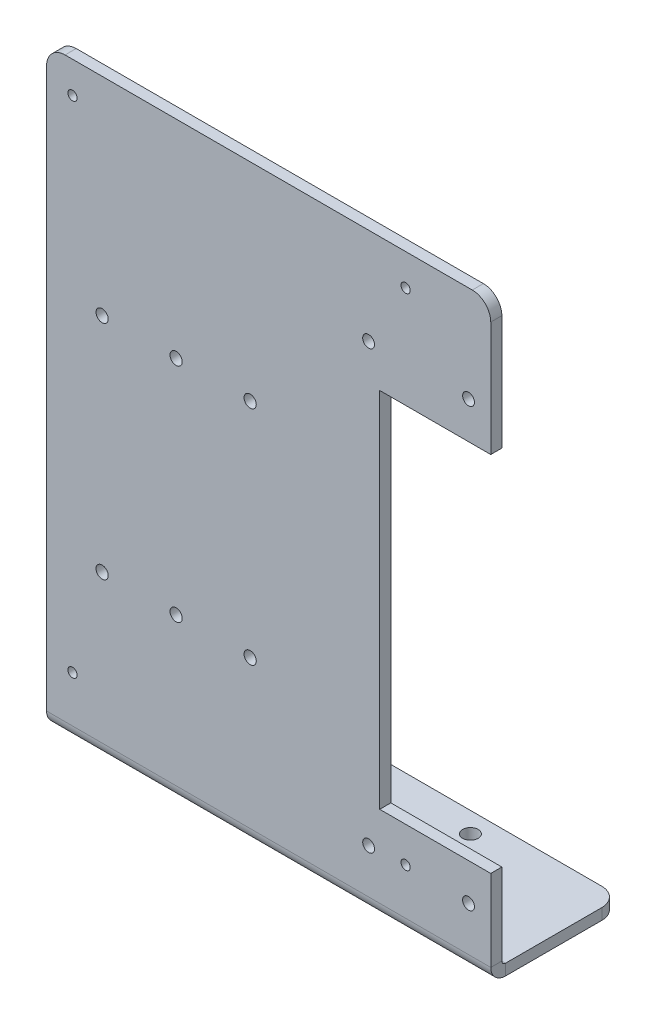
from build123d import *

# Parameters (mm, degrees)
SM_BASE_FLANGE_1_DEPTH      = 120
SKETCH_6_R                  = 1.6
CUT_EXTRUDE_1_DEPTH         = 188.147001045
PATTERN_LINEAR_1_COUNT      = 2
PATTERN_LINEAR_1_PITCH      = 118
PATTERN_LINEAR_1_COUNT_DIR2 = 5
PATTERN_LINEAR_1_PITCH_DIR2 = 27
SKETCH_7_R                  = 2.1
CUT_EXTRUDE_2_DEPTH         = 188.683243791
PATTERN_LINEAR_2_COUNT      = 2
PATTERN_LINEAR_2_PITCH      = 20
PATTERN_LINEAR_2_COUNT_DIR2 = 2
PATTERN_LINEAR_2_PITCH_DIR2 = 50
M4X0_7_TAPPED_HOLE1_D       = 3.3
PATTERN_LINEAR_4_COUNT      = 3
PATTERN_LINEAR_4_PITCH      = 20
PATTERN_LINEAR_4_COUNT_DIR2 = 4
PATTERN_LINEAR_4_PITCH_DIR2 = 20
SKETCH6_W                   = 120
SKETCH6_H                   = 3
BOSS_EXTRUDE1_DEPTH         = 20
SKETCH_11_R                 = 3.02820634
SKETCH_11_R_2               = 2.816705121
EXTRUDE_1_DEPTH             = 3
M3X0_5_1_D                  = 2.5
SKETCH_13_W                 = 30
SKETCH_13_H                 = 98
CUT_EXTRUDE_3_DEPTH         = 204.039405042
FILLET_1_R                  = 5


# Sheet-metal steps are written as plain solids
with BuildPart() as part:
    # Sketch 1 → 基材-凸緣1 (new body)
    with BuildSketch(Plane(origin=(0, 0, 0), x_dir=(0, 0, -1), z_dir=(1, 0, 0))):
        with BuildLine():
            Line((35, 0), (4, 0))
            ThreePointArc((4, 0), (1.171572875, 1.171572875), (0, 4))
            Line((0, 4), (0, 140))
            Line((0, 140), (3, 140))
            Line((3, 140), (3, 4))
            ThreePointArc((3, 4), (3.292893219, 3.292893219), (4, 3))
            Line((4, 3), (35, 3))
            Line((35, 3), (35, 0))
        make_face()
    extrude(amount=SM_BASE_FLANGE_1_DEPTH)

    # 草圖6 → 除料-伸長1 (cut, through all)
    with BuildSketch(Plane(origin=(0, 0, -3), x_dir=(-1, 0, 0), z_dir=(0, 0, -1))):
        with Locations((-6, 134)):
            Circle(SKETCH_6_R)
    cut_extrude_1 = extrude(amount=-CUT_EXTRUDE_1_DEPTH, mode=Mode.SUBTRACT)

    # 直線複製排列1: Cut-Extrude 1 2 × 5, 4 skipped
    with Locations(*[(j * PATTERN_LINEAR_1_PITCH_DIR2, -i * PATTERN_LINEAR_1_PITCH, 0) for i in range(PATTERN_LINEAR_1_COUNT) for j in range(PATTERN_LINEAR_1_COUNT_DIR2) if (i, j) not in ((0, 0), (0, 1), (0, 2), (1, 1), (1, 2))]):
        add(cut_extrude_1, mode=Mode.SUBTRACT)

    # 草圖7 → 除料-伸長2 (cut, through all)
    with BuildSketch(Plane.XZ):
        with Locations(Location((35, -9.5, 0), (0, 0, 270))):
            Circle(SKETCH_7_R)
    cut_extrude_2 = extrude(amount=-CUT_EXTRUDE_2_DEPTH, mode=Mode.SUBTRACT)

    # 直線複製排列2: Cut-Extrude 2 2 × 2
    with Locations(*[(j * PATTERN_LINEAR_2_PITCH_DIR2, 0, -i * PATTERN_LINEAR_2_PITCH) for i in range(PATTERN_LINEAR_2_COUNT) for j in range(PATTERN_LINEAR_2_COUNT_DIR2) if (i, j) != (0, 0)]):
        add(cut_extrude_2, mode=Mode.SUBTRACT)

    # M4x0.7 Tapped Hole1 (through all)
    with Locations(Plane.XY):
        with Locations((15, 104)):
            m4x0_7_tapped_hole1 = Hole(M4X0_7_TAPPED_HOLE1_D / 2)

    # 直線複製排列4: M4x0.7 Tapped Hole1 3 × 4, 6 skipped
    with Locations(*[(i * PATTERN_LINEAR_4_PITCH, -j * PATTERN_LINEAR_4_PITCH_DIR2, 0) for i in range(PATTERN_LINEAR_4_COUNT) for j in range(PATTERN_LINEAR_4_COUNT_DIR2) if (i, j) not in ((0, 0), (0, 1), (0, 2), (1, 1), (1, 2), (2, 1), (2, 2))]):
        add(m4x0_7_tapped_hole1, mode=Mode.SUBTRACT)

    # Sketch6 → Boss-Extrude1 (add)
    with BuildSketch(Plane(origin=(0, 140, 0), x_dir=(1, 0, 0), z_dir=(0, 1, 0))):
        with Locations((60, 1.5)):
            Rectangle(SKETCH6_W, SKETCH6_H)
    extrude(amount=BOSS_EXTRUDE1_DEPTH)

    # 草圖11 → 填料-伸長1 (add)
    with BuildSketch(Plane.XY):
        with Locations((6, 134)):
            Circle(SKETCH_11_R)
        with Locations((6, 16)):
            Circle(SKETCH_11_R_2)
    extrude(amount=-EXTRUDE_1_DEPTH)

    # M3x0.5 螺紋孔1 (through all)
    with Locations(Plane(origin=(97, 151.5, -3), x_dir=(-1, 0, 0), z_dir=(0, 0, -1))):
        with Locations((0, 0), (90, 0), (0, -135), (90, -135)):
            Hole(M3X0_5_1_D / 2)

    # 草圖13 → 除料-伸長3 (cut, through all)
    with BuildSketch(Plane.XY):
        with Locations((105, 75)):
            Rectangle(SKETCH_13_W, SKETCH_13_H)
    extrude(amount=-CUT_EXTRUDE_3_DEPTH, mode=Mode.SUBTRACT)

    # 圓角1
    fillet_1_edges = [part.edges().sort_by_distance(p)[0] for p in [
        (120, 1.5, -35),
        (0, 1.5, -35),
        (0, 160, -1.5),
        (120, 160, -1.5),
    ]]
    fillet(fillet_1_edges, radius=FILLET_1_R)


solid = part.part
